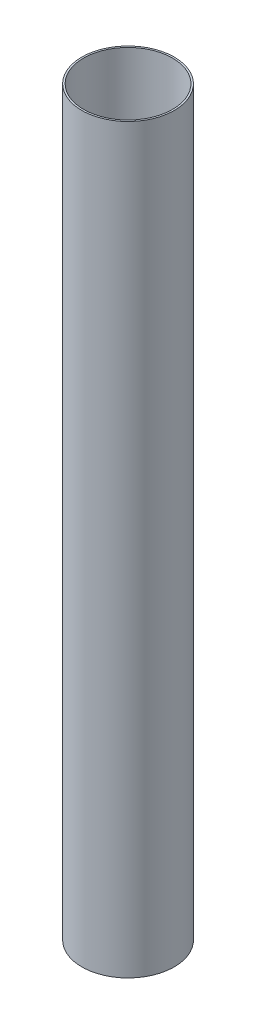
from build123d import *

# Parameters (mm, degrees)
SKETCH4_R           = 39.6
SKETCH4_R_2         = 38.1
BOSS_EXTRUDE2_DEPTH = 635


with BuildPart() as part:
    # Sketch4 → Boss-Extrude2 (new body)
    with BuildSketch(Plane(origin=(0, 0, 0), x_dir=(1, 0, 0), z_dir=(0, 1, 0))):
        with Locations((-10.030463542, 2.712784458)):
            Circle(SKETCH4_R)
        with Locations((-10.030463542, 2.712784458)):
            Circle(SKETCH4_R_2, mode=Mode.SUBTRACT)
    extrude(amount=BOSS_EXTRUDE2_DEPTH)


solid = part.part
